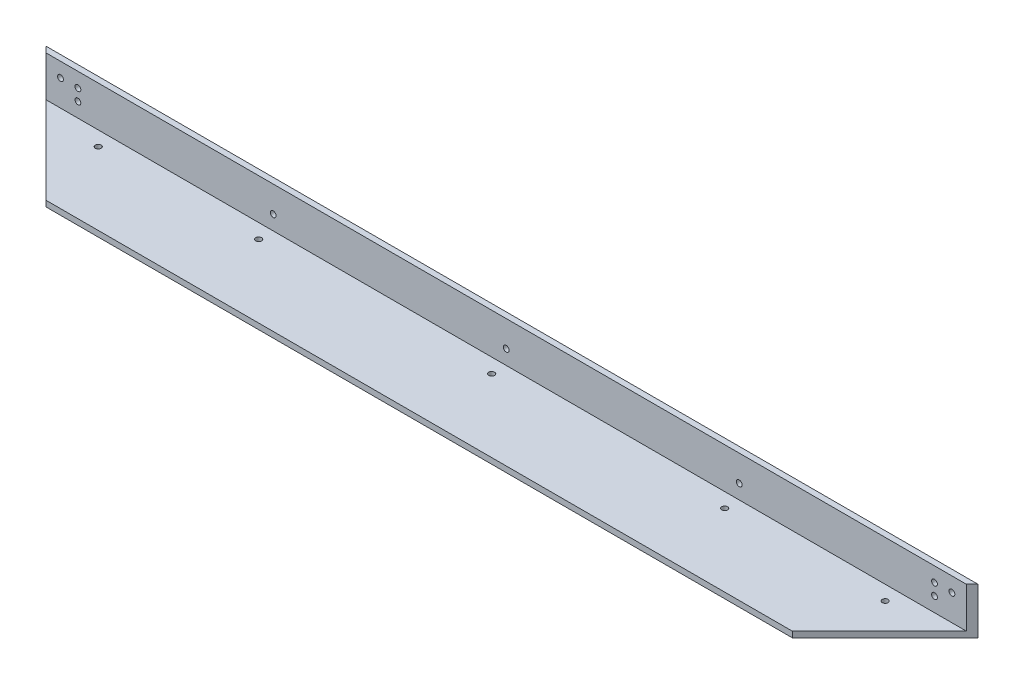
from build123d import *

# Parameters (mm, degrees)
BOSS_EXTRUDE1_DEPTH              = 510
CHAMFER6_SIZE                    = 50.8
CHAMFER7_SIZE                    = 50.8
BOTTOMHOLES_SKETCH3_R            = 1.5875
BOTTOMHOLES_CUT_EXTRUDE1_DEPTH   = 514.152803753
BACKSIDEHOLES_SKETCH2_R          = 1.5875
BACKSIDEHOLES_CUT_EXTRUDE2_DEPTH = 514.152803753


with BuildPart() as part:
    # Sketch1 → Boss-Extrude1 (new body)
    with BuildSketch(Plane(origin=(0, 0, 0), x_dir=(0, 0, -1), z_dir=(1, 0, 0))):
        Polygon((0, 0), (-50.8, 0), (-50.8, 3.175), (-3.175, 3.175), (-3.175, 25.4), (0, 25.4), align=None)
    extrude(amount=BOSS_EXTRUDE1_DEPTH)

    # Chamfer6
    chamfer6_edges = [part.edges().sort_by_distance(p)[0] for p in [
        (510, 1.5875, 50.8),
    ]]
    chamfer(chamfer6_edges, length=CHAMFER6_SIZE - 0.0001)  # a hair under: the kernel refuses the full size

    # Chamfer7
    chamfer7_edges = [part.edges().sort_by_distance(p)[0] for p in [
        (0, 1.5875, 50.8),
    ]]
    chamfer(chamfer7_edges, length=CHAMFER7_SIZE - 0.0001)  # a hair under: the kernel refuses the full size

    # BottomHoles-Sketch3 → BottomHoles-Cut-Extrude1 (cut, through all)
    with BuildSketch(Plane.XZ):
        with Locations(Location((39.6875, 11.1125, 0), (0, 0, 270))):
            Circle(BOTTOMHOLES_SKETCH3_R)
        with Locations(Location((470.3125, 11.1125, 0), (0, 0, 270))):
            Circle(BOTTOMHOLES_SKETCH3_R)
        with Locations(Location((127.5, 11.1125, 0), (0, 0, 270))):
            Circle(BOTTOMHOLES_SKETCH3_R)
        with Locations(Location((255, 11.1125, 0), (0, 0, 270))):
            Circle(BOTTOMHOLES_SKETCH3_R)
        with Locations(Location((382.5, 11.1125, 0), (0, 0, 270))):
            Circle(BOTTOMHOLES_SKETCH3_R)
    extrude(amount=-BOTTOMHOLES_CUT_EXTRUDE1_DEPTH, mode=Mode.SUBTRACT)

    # BackSideHoles-Sketch2 → BackSideHoles-Cut-Extrude2 (cut, through all)
    with BuildSketch(Plane(origin=(0, 0, 0), x_dir=(-1, 0, 0), z_dir=(0, 0, -1))):
        with Locations(Location((-498.8875, 17.4625, 0), (0, 0, 90))):
            Circle(BACKSIDEHOLES_SKETCH2_R)
        with Locations(Location((-489.3625, 17.4625, 0), (0, 0, 90))):
            Circle(BACKSIDEHOLES_SKETCH2_R)
        with Locations(Location((-20.6375, 17.4625, 0), (0, 0, 90))):
            Circle(BACKSIDEHOLES_SKETCH2_R)
        with Locations(Location((-11.1125, 17.4625, 0), (0, 0, 90))):
            Circle(BACKSIDEHOLES_SKETCH2_R)
        with Locations(Location((-20.6375, 11.1125, 0), (0, 0, 90))):
            Circle(BACKSIDEHOLES_SKETCH2_R)
        with Locations(Location((-489.3625, 11.1125, 0), (0, 0, 90))):
            Circle(BACKSIDEHOLES_SKETCH2_R)
        with Locations(Location((-382.5, 11.1125, 0), (0, 0, 90))):
            Circle(BACKSIDEHOLES_SKETCH2_R)
        with Locations(Location((-255, 11.1125, 0), (0, 0, 90))):
            Circle(BACKSIDEHOLES_SKETCH2_R)
        with Locations(Location((-127.5, 11.1125, 0), (0, 0, 90))):
            Circle(BACKSIDEHOLES_SKETCH2_R)
    extrude(amount=-BACKSIDEHOLES_CUT_EXTRUDE2_DEPTH, mode=Mode.SUBTRACT)


solid = part.part
